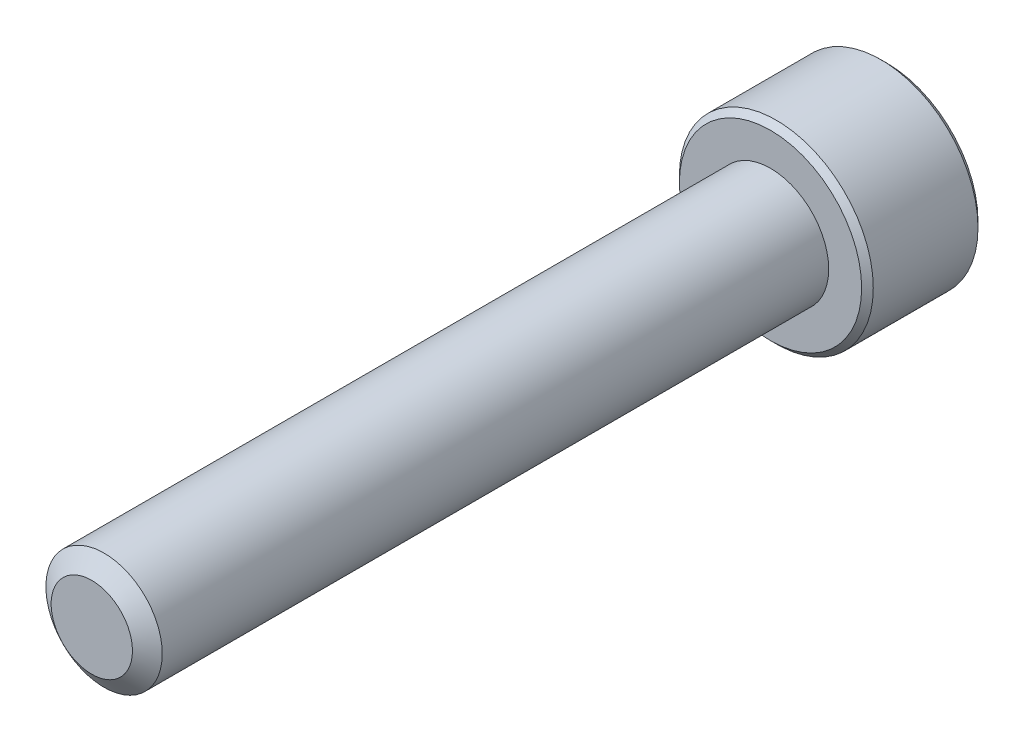
from build123d import *

# Parameters (mm, degrees)
SKETCH1_R          = 3
EXTRUDE1_DEPTH     = 35
SKETCH6_R          = 5
EXTRUDE2_DEPTH     = 6
CUT_EXTRUDE1_DEPTH = 3.75
CHAMFER1_SIZE      = 0.3


with BuildPart() as part:
    # Sketch1 → Extrude1 (new body)
    with BuildSketch(Plane.XY):
        Circle(SKETCH1_R)
    extrude(amount=-EXTRUDE1_DEPTH)

    # Sketch4 → Cut-Revolve1 (revolve, cut)
    with BuildSketch(Plane(origin=(0, 0, 0), x_dir=(0, 0, -1), z_dir=(1, 0, 0))):
        Polygon((0.632650852, 3), (0, 2.096480947), (0, 3), align=None)
    revolve(axis=Axis((0, 0, 0), (0, 0, -1)), mode=Mode.SUBTRACT)

    # Sketch6 → Extrude2 (add)
    with BuildSketch(Plane(origin=(0, 0, -35), x_dir=(-1, 0, 0), z_dir=(0, 0, -1))):
        Circle(SKETCH6_R)
    extrude(amount=EXTRUDE2_DEPTH)

    # Sketch7 → Cut-Extrude1 (cut)
    with BuildSketch(Plane(origin=(0, 0, -41), x_dir=(-1, 0, 0), z_dir=(0, 0, -1))):
        Polygon((0, 2.886751346), (-2.5, 1.443375673), (-2.5, -1.443375673), (0, -2.886751346), (2.5, -1.443375673), (2.5, 1.443375673), align=None)
    extrude(amount=-CUT_EXTRUDE1_DEPTH, mode=Mode.SUBTRACT)

    # Cut-Extrude2 cone 1 section (through the dimple's axis) → Cut-Extrude2 (revolve, cut)
    with BuildSketch(Plane(origin=(0, 0, -41), x_dir=(0, 1, 0), z_dir=(1, 0, 0))):
        Polygon((0, 0), (2.886751346, 0), (0, 2.886751346), align=None)
    revolve(axis=Axis((0, 0, -41), (0, 0, 1)), mode=Mode.SUBTRACT)

    # Chamfer1
    chamfer1_edges = [part.edges().sort_by_distance(p)[0] for p in [
        (5, 0, -41),
        (5, 0, -35),
    ]]
    chamfer(chamfer1_edges, length=CHAMFER1_SIZE)

    # Sketch10 → Revolve1 (revolve)
    with BuildSketch(Plane(origin=(0, 0, 0), x_dir=(0, 0, -1), z_dir=(1, 0, 0))):
        Polygon((35, 3), (35, 0), (33.507359313, 0), (34.75, 3), align=None)
    revolve(axis=Axis((0, 0, -35), (0, 0, 1)))


solid = part.part
